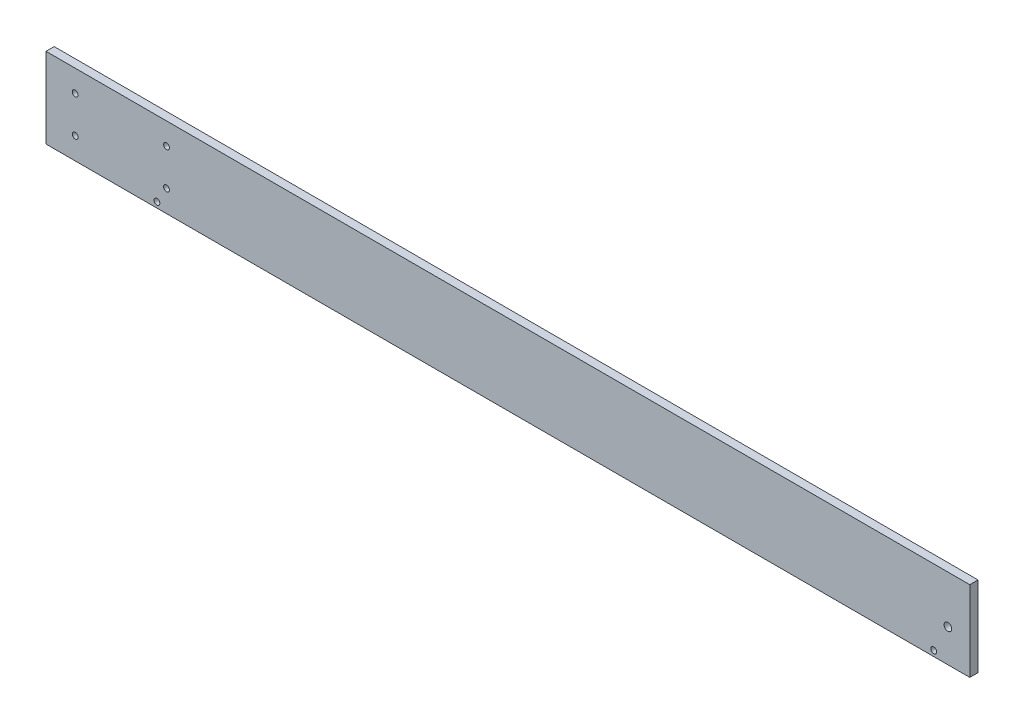
from build123d import *

# Parameters (mm, degrees)
SKETCH1_W           = 506
SKETCH1_H           = 44
SKETCH1_R           = 2.1
SKETCH1_R_2         = 1.6
BOSS_EXTRUDE1_DEPTH = 4.5


with BuildPart() as part:
    # Sketch1 → Boss-Extrude1 (new body)
    with BuildSketch(Plane.XY):
        Rectangle(SKETCH1_W, SKETCH1_H)
        with Locations((241, -4)):
            Circle(SKETCH1_R, mode=Mode.SUBTRACT)
        with Locations((-237, 10)):
            Circle(SKETCH1_R_2, mode=Mode.SUBTRACT)
        with Locations((-187, 10)):
            Circle(SKETCH1_R_2, mode=Mode.SUBTRACT)
        with Locations((-187, -10)):
            Circle(SKETCH1_R_2, mode=Mode.SUBTRACT)
        with Locations((-237, -10)):
            Circle(SKETCH1_R_2, mode=Mode.SUBTRACT)
        with Locations((233.25, -19)):
            Circle(SKETCH1_R_2, mode=Mode.SUBTRACT)
        with Locations((-192.25, -19)):
            Circle(SKETCH1_R_2, mode=Mode.SUBTRACT)
    extrude(amount=BOSS_EXTRUDE1_DEPTH)


solid = part.part
